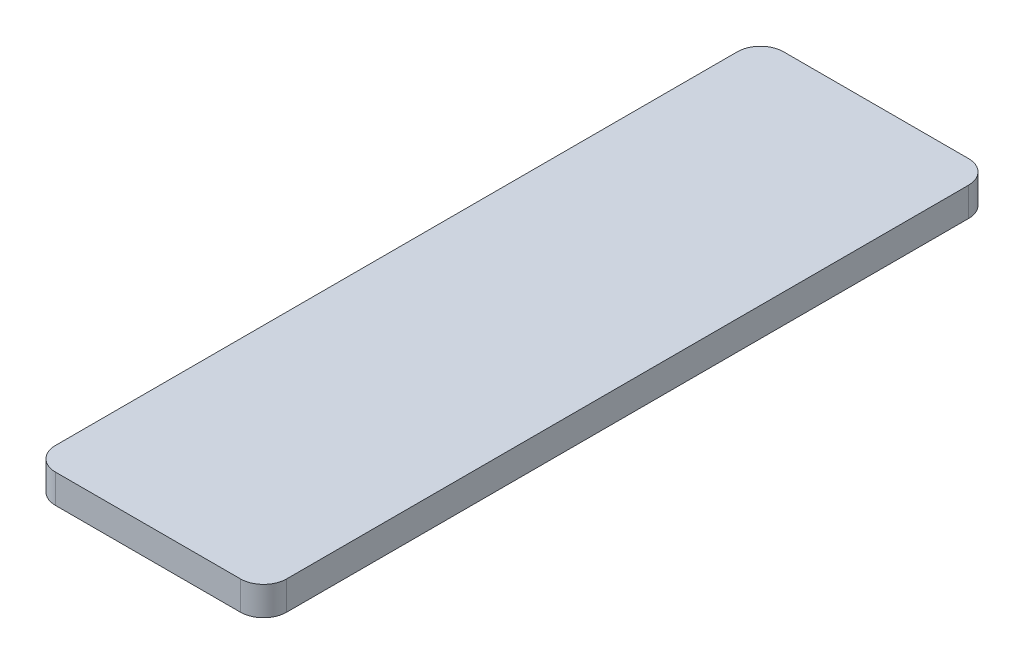
from build123d import *

# Parameters (mm, degrees)
SKETCH1_W           = 25.4
SKETCH1_H           = 80
BOSS_EXTRUDE1_DEPTH = 3.175
FILLET1_R           = 2.54


with BuildPart() as part:
    # Sketch1 → Boss-Extrude1 (new body)
    with BuildSketch(Plane(origin=(0, 0, 0), x_dir=(1, 0, 0), z_dir=(0, 1, 0))):
        with Locations((-13.581081081, 16.216216216)):
            Rectangle(SKETCH1_W, SKETCH1_H)
    extrude(amount=BOSS_EXTRUDE1_DEPTH)

    # Fillet1
    fillet1_edges = [part.edges().sort_by_distance(p)[0] for p in [
        (-26.281081081, 1.5875, -56.216216216),
        (-0.881081081, 1.5875, -56.216216216),
        (-0.881081081, 1.5875, 23.783783784),
        (-26.281081081, 1.5875, 23.783783784),
    ]]
    fillet(fillet1_edges, radius=FILLET1_R)


solid = part.part
